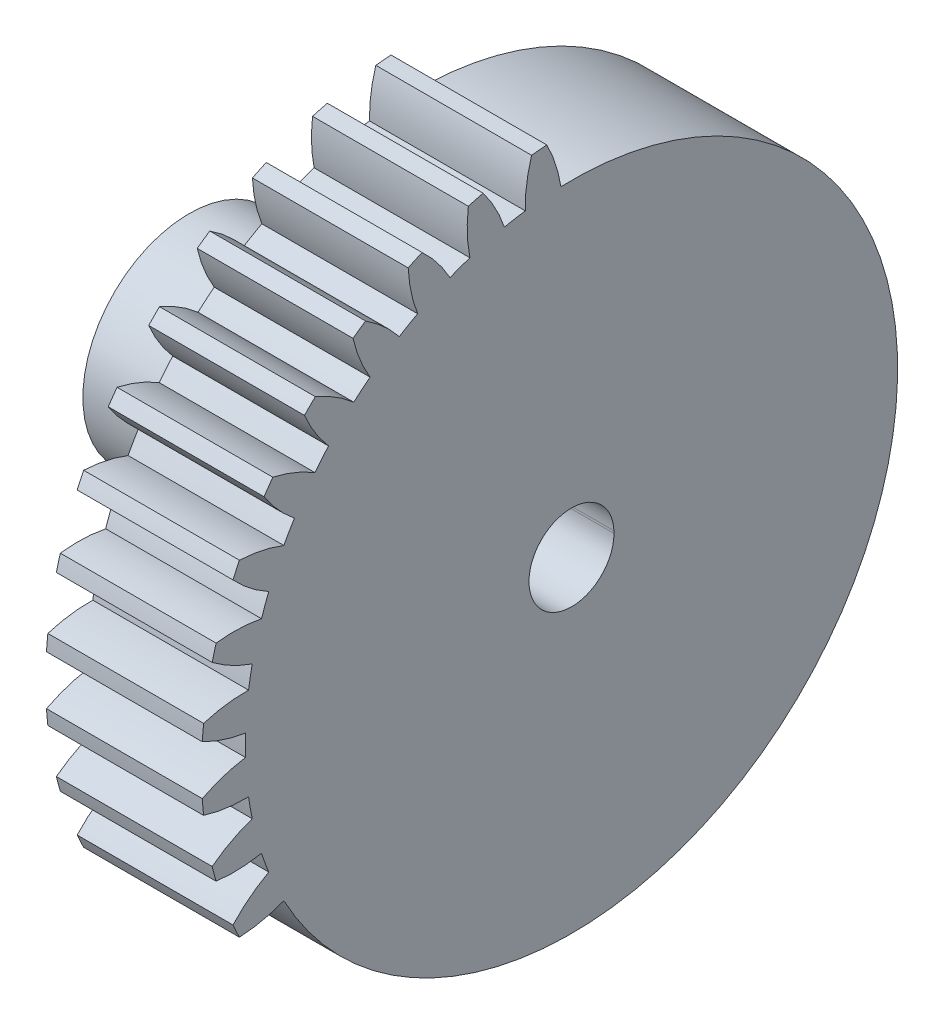
from build123d import *

# Parameters (mm, degrees)
SKETCH1_W                    = 11
SKETCH1_H                    = 26.125
CUT_EXTRUDE1_DEPTH           = 43.506639989
CUT_EXTRUDE2_DEPTH           = 43.506639989
CUT_EXTRUDE3_DEPTH           = 43.506639989
CUT_EXTRUDE4_DEPTH           = 43.506639989
CUT_EXTRUDE5_DEPTH           = 43.506639989
CUT_EXTRUDE6_DEPTH           = 43.506639989
CUT_EXTRUDE7_DEPTH           = 43.506639989
CUT_EXTRUDE8_DEPTH           = 43.506639989
CUT_EXTRUDE9_DEPTH           = 43.506639989
CUT_EXTRUDE10_DEPTH          = 43.506639989
CUT_EXTRUDE11_DEPTH          = 43.468291129
CUT_EXTRUDE12_DEPTH          = 43.468291129
CUT_EXTRUDE13_DEPTH          = 43.468291129
SKETCH15_W                   = 16.0000508
SKETCH15_H                   = 7.5
F_6_0_6_DIAMETER_HOLE1_D     = 6
F_6_0_6_DIAMETER_HOLE1_DEPTH = 22.0000508
CUT_EXTRUDE14_DEPTH          = 45.792969961
CUT_EXTRUDE14_DEPTH_BACK     = 45.792969961
SKETCH22_R                   = 2.990861642
CUT_EXTRUDE15_DEPTH          = 45.792969961
CUT_EXTRUDE15_DEPTH_BACK     = 45.792969961
SKETCH23_R                   = 1.5
SPLIT1_START                 = 6.995955282
SPLIT1_DEPTH                 = 11


# Read off the part's stored shape, not the designer's step: Split1
with BuildPart() as part:
    # Sketch1 → Revolve1 (revolve)
    with BuildSketch(Plane(origin=(0, 0, -3.755095368), x_dir=(-1, 0, 0), z_dir=(0, 0, -1)), mode=Mode.PRIVATE) as revolve1_sk:
        with Locations((-12.495955282, 15.097655255)):
            Rectangle(SKETCH1_W, SKETCH1_H)
    revolve(revolve1_sk.sketch.rotate(Axis((17.995955282, 2.035155255, -3.755095368), (-1, 0, 0)), 270), axis=Axis((17.995955282, 2.035155255, -3.755095368), (-1, 0, 0)))

    # Sketch2 → Cut-Extrude1 (cut, through all)
    with BuildSketch(Plane.ZY.offset(-6.995955282)):
        with BuildLine():
            ThreePointArc((14.332392383, 20.8861078), (13.037730936, 22.048066331), (11.668609565, 23.121286981))
            ThreePointArc((11.668609565, 23.121286981), (11.189500109, 21.585967652), (10.468111889, 20.148487096))
            ThreePointArc((10.468111889, 20.148487096), (11.04846398, 19.677350291), (11.613220242, 19.187627099))
            ThreePointArc((11.613220242, 19.187627099), (12.903594489, 20.14767169), (14.332392383, 20.8861078))
        make_face()
    extrude(amount=-CUT_EXTRUDE1_DEPTH, mode=Mode.SUBTRACT)

    # Sketch3 → Cut-Extrude2 (cut, through all)
    with BuildSketch(Plane.ZY.offset(-6.995955282)):
        with BuildLine():
            ThreePointArc((17.331036359, 17.458860187), (16.257815709, 18.827981558), (15.095857178, 20.122643005))
            ThreePointArc((15.095857178, 20.122643005), (14.357421068, 18.693845111), (13.397376477, 17.403470864))
            ThreePointArc((13.397376477, 17.403470864), (13.887099669, 16.838714603), (14.358236474, 16.258362511))
            ThreePointArc((14.358236474, 16.258362511), (15.79571703, 16.979750731), (17.331036359, 17.458860187))
        make_face()
    extrude(amount=-CUT_EXTRUDE2_DEPTH, mode=Mode.SUBTRACT)

    # Sketch4 → Cut-Extrude3 (cut, through all)
    with BuildSketch(Plane.ZY.offset(-6.995955282)):
        with BuildLine():
            ThreePointArc((19.688988892, 13.562971103), (18.869818306, 15.097655255), (17.950328137, 16.574419867))
            ThreePointArc((17.950328137, 16.574419867), (16.97500238, 15.295556708), (15.805471888, 14.191496139))
            ThreePointArc((15.805471888, 14.191496139), (16.189686188, 13.550280255), (16.552888283, 12.896932968))
            ThreePointArc((16.552888283, 12.896932968), (18.093798029, 13.3577458), (19.688988892, 13.562971103))
        make_face()
    extrude(amount=-CUT_EXTRUDE3_DEPTH, mode=Mode.SUBTRACT)

    # Sketch5 → Cut-Extrude4 (cut, through all)
    with BuildSketch(Plane.ZY.offset(-6.995955282)):
        with BuildLine():
            ThreePointArc((21.334604788, 9.316815169), (20.794374351, 10.970431499), (20.145290787, 12.584428531))
            ThreePointArc((20.145290787, 12.584428531), (18.962710163, 11.494357717), (17.619229361, 10.610157148))
            ThreePointArc((17.619229361, 10.610157148), (17.886260612, 9.91196466), (18.130492286, 9.205473805))
            ThreePointArc((18.130492286, 9.205473805), (19.728011459, 9.391709686), (21.334604788, 9.316815169))
        make_face()
    extrude(amount=-CUT_EXTRUDE4_DEPTH, mode=Mode.SUBTRACT)

    # Sketch6 → Cut-Extrude5 (cut, through all)
    with BuildSketch(Plane.ZY.offset(-6.995955282)):
        with BuildLine():
            ThreePointArc((22.217882841, 4.849409683), (21.97300718, 6.571713896), (21.614052298, 8.273902864))
            ThreePointArc((21.614052298, 8.273902864), (20.26014892, 7.405745646), (18.783538793, 6.768271063))
            ThreePointArc((18.783538793, 6.768271063), (18.925273386, 6.034316198), (19.043113783, 5.296148141))
            ThreePointArc((19.043113783, 5.296148141), (20.648702571, 5.202148388), (22.217882841, 4.849409683))
        make_face()
    extrude(amount=-CUT_EXTRUDE5_DEPTH, mode=Mode.SUBTRACT)

    # Sketch7 → Cut-Extrude6 (cut, through all)
    with BuildSketch(Plane.ZY.offset(-6.995955282)):
        with BuildLine():
            ThreePointArc((22.311985094, 0.2964945), (22.369904632, 2.035155255), (22.311985094, 3.773816009))
            ThreePointArc((22.311985094, 3.773816009), (20.827896632, 3.153950904), (19.263023231, 2.78257165))
            ThreePointArc((19.263023231, 2.78257165), (19.275154632, 2.035155255), (19.263023231, 1.287738859))
            ThreePointArc((19.263023231, 1.287738859), (20.827896632, 0.916359605), (22.311985094, 0.2964945))
        make_face()
    extrude(amount=-CUT_EXTRUDE6_DEPTH, mode=Mode.SUBTRACT)

    # Sketch8 → Cut-Extrude7 (cut, through all)
    with BuildSketch(Plane.ZY.offset(-6.995955282)):
        with BuildLine():
            ThreePointArc((21.614052298, -4.203592355), (21.97300718, -2.501403387), (22.217882841, -0.779099174))
            ThreePointArc((22.217882841, -0.779099174), (20.648702571, -1.131837878), (19.043113783, -1.225837632))
            ThreePointArc((19.043113783, -1.225837632), (18.925273386, -1.964005689), (18.783538793, -2.697960554))
            ThreePointArc((18.783538793, -2.697960554), (20.26014892, -3.335435137), (21.614052298, -4.203592355))
        make_face()
    extrude(amount=-CUT_EXTRUDE7_DEPTH, mode=Mode.SUBTRACT)

    # Sketch9 → Cut-Extrude8 (cut, through all)
    with BuildSketch(Plane.ZY.offset(-6.995955282)):
        with BuildLine():
            ThreePointArc((20.145290787, -8.514118022), (20.794374351, -6.90012099), (21.334604788, -5.24650466))
            ThreePointArc((21.334604788, -5.24650466), (19.728011459, -5.321399177), (18.130492286, -5.135163296))
            ThreePointArc((18.130492286, -5.135163296), (17.886260612, -5.841654151), (17.619229361, -6.539846639))
            ThreePointArc((17.619229361, -6.539846639), (18.962710163, -7.424047208), (20.145290787, -8.514118022))
        make_face()
    extrude(amount=-CUT_EXTRUDE8_DEPTH, mode=Mode.SUBTRACT)

    # Sketch10 → Cut-Extrude9 (cut, through all)
    with BuildSketch(Plane.ZY.offset(-6.995955282)):
        with BuildLine():
            ThreePointArc((17.950328137, -12.504109358), (18.869818306, -11.027344745), (19.688988892, -9.492660594))
            ThreePointArc((19.688988892, -9.492660594), (18.093798029, -9.287435291), (16.552888283, -8.826622459))
            ThreePointArc((16.552888283, -8.826622459), (16.189686188, -9.479969745), (15.805471888, -10.12118563))
            ThreePointArc((15.805471888, -10.12118563), (16.97500238, -11.225246199), (17.950328137, -12.504109358))
        make_face()
    extrude(amount=-CUT_EXTRUDE9_DEPTH, mode=Mode.SUBTRACT)

    # Sketch11 → Cut-Extrude10 (cut, through all)
    with BuildSketch(Plane.ZY.offset(-6.995955282)):
        with BuildLine():
            ThreePointArc((-2.016434613, 28.102235716), (-3.755095368, 28.160155255), (-5.493756122, 28.102235716))
            ThreePointArc((-5.493756122, 28.102235716), (-4.873891017, 26.618147254), (-4.502511763, 25.053273853))
            ThreePointArc((-4.502511763, 25.053273853), (-3.755095368, 25.065405255), (-3.007678972, 25.053273853))
            ThreePointArc((-3.007678972, 25.053273853), (-2.636299718, 26.618147254), (-2.016434613, 28.102235716))
        make_face()
    extrude(amount=-CUT_EXTRUDE10_DEPTH, mode=Mode.SUBTRACT)

    # Sketch12 → Cut-Extrude11 (cut, through all)
    with BuildSketch(Plane.ZY.offset(-6.995955282)):
        with BuildLine():
            ThreePointArc((2.483652242, 27.40430292), (0.781463274, 27.763257802), (-0.940840939, 28.008133463))
            ThreePointArc((-0.940840939, 28.008133463), (-0.588102235, 26.438953193), (-0.494102481, 24.833364405))
            ThreePointArc((-0.494102481, 24.833364405), (0.244065576, 24.715524008), (0.978020441, 24.573789415))
            ThreePointArc((0.978020441, 24.573789415), (1.615495024, 26.050399542), (2.483652242, 27.40430292))
        make_face()
    extrude(amount=-CUT_EXTRUDE11_DEPTH, mode=Mode.SUBTRACT)

    # Sketch13 → Cut-Extrude12 (cut, through all)
    with BuildSketch(Plane.ZY.offset(-6.995955282)):
        with BuildLine():
            ThreePointArc((6.794177909, 25.935541409), (5.180180877, 26.584624973), (3.526564547, 27.12485541))
            ThreePointArc((3.526564547, 27.12485541), (3.601459064, 25.518262081), (3.415223183, 23.920742908))
            ThreePointArc((3.415223183, 23.920742908), (4.121714038, 23.676511234), (4.819906526, 23.409479983))
            ThreePointArc((4.819906526, 23.409479983), (5.704107095, 24.752960785), (6.794177909, 25.935541409))
        make_face()
    extrude(amount=-CUT_EXTRUDE12_DEPTH, mode=Mode.SUBTRACT)

    # Sketch14 → Cut-Extrude13 (cut, through all)
    with BuildSketch(Plane.ZY.offset(-6.995955282)):
        with BuildLine():
            ThreePointArc((10.784169245, 23.740578759), (9.307404632, 24.660068928), (7.772720481, 25.479239514))
            ThreePointArc((7.772720481, 25.479239514), (7.567495178, 23.884048652), (7.106682346, 22.343138906))
            ThreePointArc((7.106682346, 22.343138906), (7.760029632, 21.97993681), (8.401245517, 21.59572251))
            ThreePointArc((8.401245517, 21.59572251), (9.505306086, 22.765253002), (10.784169245, 23.740578759))
        make_face()
    extrude(amount=-CUT_EXTRUDE13_DEPTH, mode=Mode.SUBTRACT)

    # Sketch15 → Revolve2 (revolve)
    with BuildSketch(Plane.XY.offset(-3.755095368), mode=Mode.PRIVATE) as revolve2_sk:
        with Locations((-1.004070118, 5.785155255)):
            Rectangle(SKETCH15_W, SKETCH15_H)
    revolve(revolve2_sk.sketch.rotate(Axis((-9.004095518, 2.035155255, -3.755095368), (1, 0, 0)), 270), axis=Axis((-9.004095518, 2.035155255, -3.755095368), (1, 0, 0)))

    # Ø6.0 (6) Diameter Hole1
    with Locations(Plane(origin=(17.995955282, 0, 0), x_dir=(0, 0, -1), z_dir=(1, 0, 0))):
        with Locations((3.755095368, 2.035155255)):
            Hole(F_6_0_6_DIAMETER_HOLE1_D / 2, depth=F_6_0_6_DIAMETER_HOLE1_DEPTH)

    # Sketch22 → Cut-Extrude14 (cut, two sides: drawn at the far end of the back side and taken through both)
    with BuildSketch(Plane(origin=(0, 0, 0), x_dir=(0, 0, -1), z_dir=(1, 0, 0)).offset(-CUT_EXTRUDE14_DEPTH_BACK)):
        with Locations((3.766902128, 1.977678158)):
            Circle(SKETCH22_R)
    extrude(amount=CUT_EXTRUDE14_DEPTH + CUT_EXTRUDE14_DEPTH_BACK, mode=Mode.SUBTRACT)

    # Sketch23 → Cut-Extrude15 (cut, two sides: drawn at the far end of the back side and taken through both)
    with BuildSketch(Plane.XY.offset(-CUT_EXTRUDE15_DEPTH_BACK)):
        with Locations((-2.691269596, 2.301526246)):
            Circle(SKETCH23_R)
    extrude(amount=CUT_EXTRUDE15_DEPTH + CUT_EXTRUDE15_DEPTH_BACK, mode=Mode.SUBTRACT)

    # Split1 outline → Split1 (cut)
    with BuildSketch(Plane.YZ.offset(SPLIT1_START)):
        with BuildLine():
            ThreePointArc((25.053273853, -4.502511763), (-9.479969745, -23.699876923), (-10.12118563, 15.805471888))
            ThreePointArc((-10.12118563, 15.805471888), (-11.225246199, 16.97500238), (-12.504109358, 17.950328137))
            ThreePointArc((-12.504109358, 17.950328137), (-11.027344745, -26.380009041), (28.102235716, -5.493756122))
            ThreePointArc((28.102235716, -5.493756122), (26.618147254, -4.873891017), (25.053273853, -4.502511763))
        make_face()
    extrude(amount=SPLIT1_DEPTH, mode=Mode.SUBTRACT)


solid = part.part
